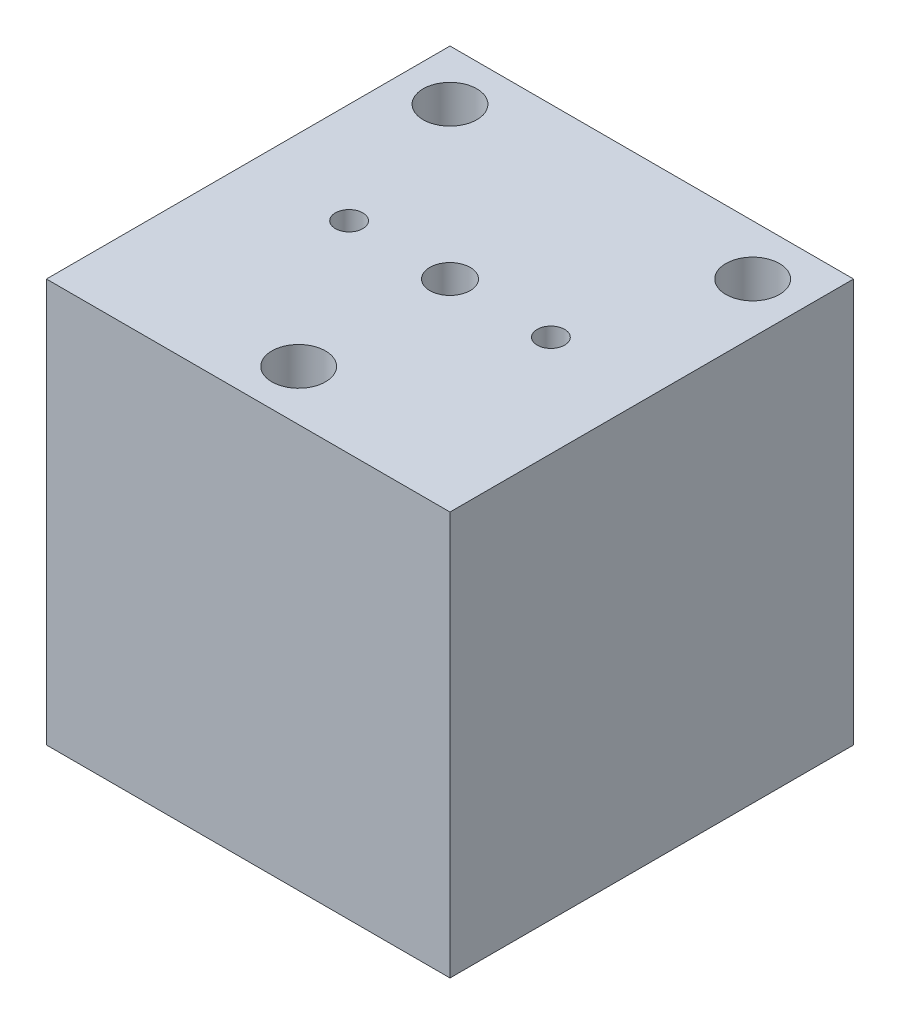
from build123d import *

# Parameters (mm, degrees)
SKETCH1_W                     = 50.8
SKETCH1_H                     = 50.8
BOSS_EXTRUDE1_DEPTH           = 50.8
F_1_4_CLEARANCE_HOLE1_D       = 6.7564
SKETCH4_R                     = 2.54
CUT_EXTRUDE1_DEPTH            = 63.217039467
TAP_DRILL_FOR_8_32_TAP1_D     = 3.4544
TAP_DRILL_FOR_8_32_TAP1_DEPTH = 12.7
TAP_DRILL_FOR_8_32_TAP1_TIP   = 1.037806461


with BuildPart() as part:
    # Sketch1 → Boss-Extrude1 (new body)
    with BuildSketch(Plane(origin=(0, 0, 0), x_dir=(1, 0, 0), z_dir=(0, 1, 0))):
        Rectangle(SKETCH1_W, SKETCH1_H)
    extrude(amount=BOSS_EXTRUDE1_DEPTH)

    # 1/4 Clearance Hole1 (through all)
    with Locations(Plane(origin=(0, 50.8, 0), x_dir=(1, 0, 0), z_dir=(0, 1, 0))):
        with Locations((-19.05, 19.05), (19.05, 19.05), (0, -19.05)):
            Hole(F_1_4_CLEARANCE_HOLE1_D / 2)

    # Sketch4 → Cut-Extrude1 (cut, through all)
    with BuildSketch(Plane(origin=(0, 50.8, 0), x_dir=(1, 0, 0), z_dir=(0, 1, 0))):
        Circle(SKETCH4_R)
    extrude(amount=-CUT_EXTRUDE1_DEPTH, mode=Mode.SUBTRACT)

    # Tap Drill for #8-32 Tap1
    with Locations(Plane(origin=(0, 50.8, 0), x_dir=(1, 0, 0), z_dir=(0, 1, 0))):
        with Locations((-12.7, 0), (12.7, 0)):
            Hole(TAP_DRILL_FOR_8_32_TAP1_D / 2, depth=TAP_DRILL_FOR_8_32_TAP1_DEPTH)
            with Locations((0, 0, -(TAP_DRILL_FOR_8_32_TAP1_DEPTH + TAP_DRILL_FOR_8_32_TAP1_TIP / 2))):  # 118° drill point
                Cone(0, TAP_DRILL_FOR_8_32_TAP1_D / 2, TAP_DRILL_FOR_8_32_TAP1_TIP, mode=Mode.SUBTRACT)


solid = part.part
